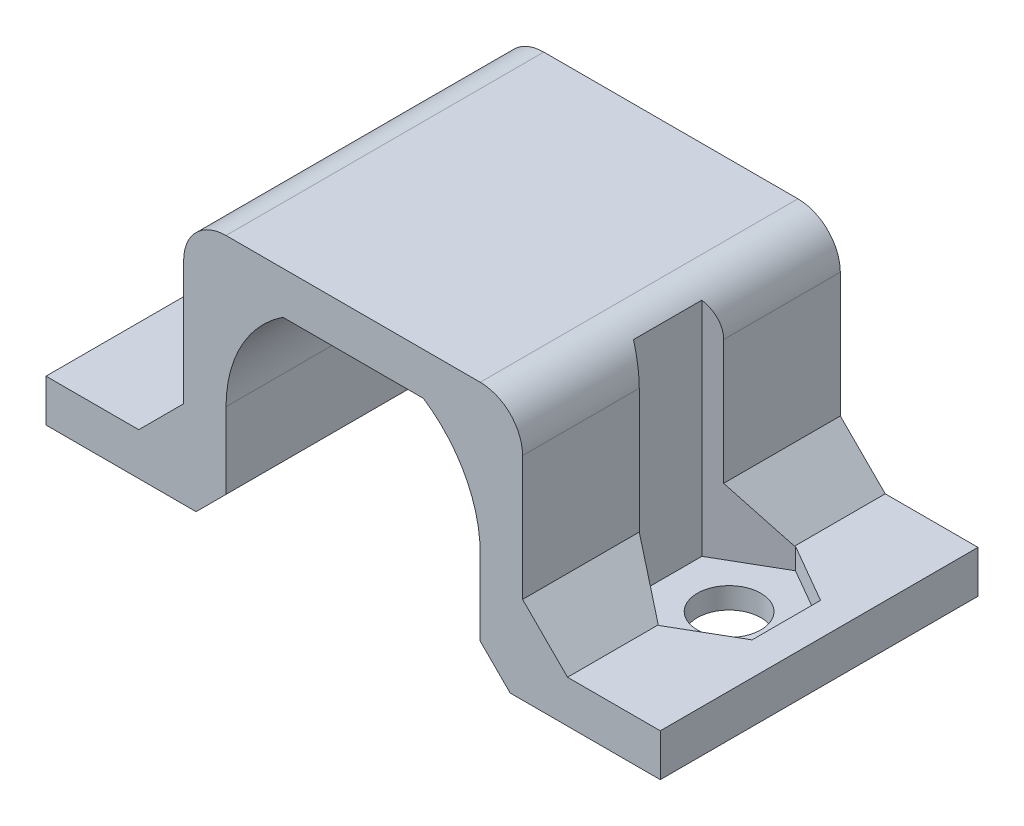
from build123d import *

# Parameters (mm, degrees)
SALIENTE_EXTRUIR1_DEPTH = 7.5
REDONDEO1_R             = 2
CORTAR_EXTRUIR2_DEPTH   = 11
CROQUIS4_R              = 1.5
CORTAR_EXTRUIR3_DEPTH   = 11


with BuildPart() as part:
    # Croquis1 → Saliente-Extruir1 (new, symmetric)
    with BuildSketch(Plane.XY):
        with BuildLine():
            Line((14.5, 0), (7.414213562, 0))
            Line((7.414213562, 0), (6, 1.414213562))
            Line((6, 1.414213562), (6, 5))
            ThreePointArc((6, 5), (5.286764074, 7.837274331), (3.31662479, 10))
            Line((3.31662479, 10), (-3.31662479, 10))
            ThreePointArc((-3.31662479, 10), (-5.286764074, 7.837274331), (-6, 5))
            Line((-6, 5), (-6, 1.414213562))
            Line((-6, 1.414213562), (-7.414213562, 0))
            Line((-7.414213562, 0), (-14.5, 0))
            Line((-14.5, 0), (-14.5, 2))
            Line((-14.5, 2), (-10.121320344, 2))
            Line((-10.121320344, 2), (-8, 4.121320344))
            Line((-8, 4.121320344), (-8, 12))
            Line((-8, 12), (8, 12))
            Line((8, 12), (8, 4.121320344))
            Line((8, 4.121320344), (10.121320344, 2))
            Line((10.121320344, 2), (14.5, 2))
            Line((14.5, 2), (14.5, 0))
        make_face()
    extrude(amount=SALIENTE_EXTRUIR1_DEPTH, both=True)

    # Redondeo1
    redondeo1_edges = [part.edges().sort_by_distance(p)[0] for p in [
        (-8, 12, 0),
        (8, 12, 0),
    ]]
    fillet(redondeo1_edges, radius=REDONDEO1_R)

    # Croquis3 → Cortar-Extruir2 (cut)
    with BuildSketch(Plane(origin=(0, 12, 0), x_dir=(1, 0, 0), z_dir=(0, 1, 0))):
        Polygon((-10.15, -3.233161507), (-7.35, -1.616580754), (-7.35, 1.616580754), (-10.15, 3.233161507), (-12.95, 1.616580754), (-12.95, -1.616580754), align=None)
        Polygon((12.95, -1.616580754), (10.15, -3.233161507), (7.35, -1.616580754), (7.35, 1.616580754), (10.15, 3.233161507), (12.95, 1.616580754), align=None)
    extrude(amount=-CORTAR_EXTRUIR2_DEPTH, mode=Mode.SUBTRACT)

    # Croquis4 → Cortar-Extruir3 (cut)
    with BuildSketch(Plane.XZ):
        with Locations((-10.25, 0)):
            Circle(CROQUIS4_R)
        with Locations((10.25, 0)):
            Circle(CROQUIS4_R)
    extrude(amount=-CORTAR_EXTRUIR3_DEPTH, mode=Mode.SUBTRACT)


solid = part.part
